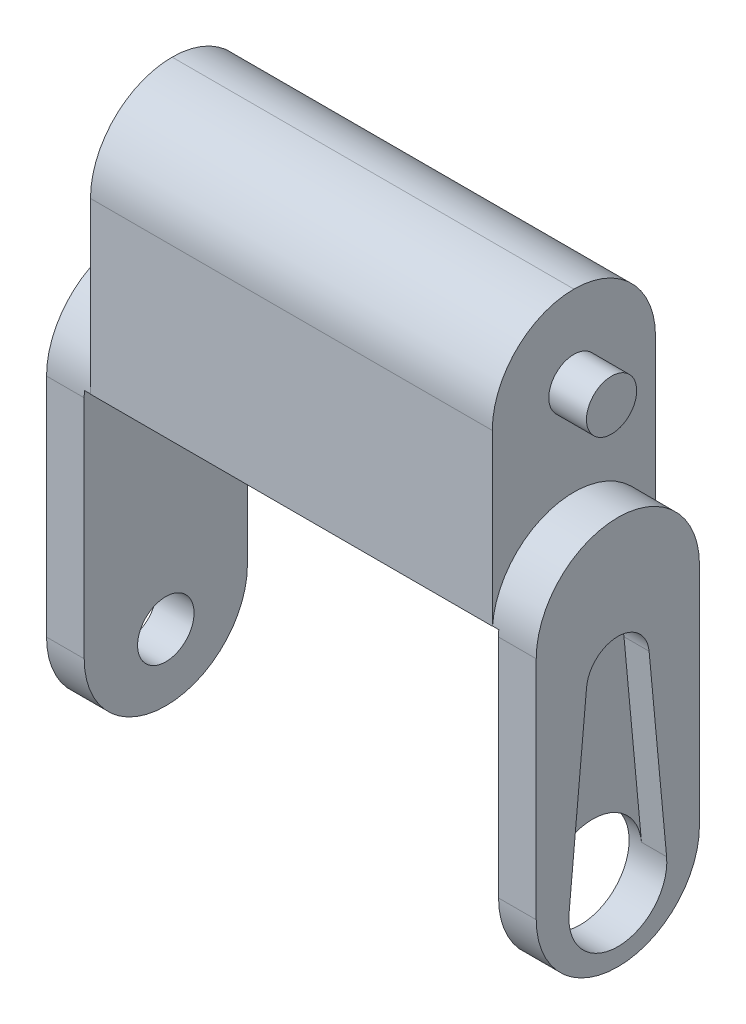
from build123d import *

# Parameters (mm, degrees)
BOSS_EXTRUDE1_DEPTH = 13
SKETCH2_R           = 2.25
CUT_EXTRUDE1_DEPTH  = 3
SKETCH3_R           = 2
BOSS_EXTRUDE3_DEPTH = 3
BOSS_EXTRUDE4_START = 3
SKETCH4_R           = 2
BOSS_EXTRUDE4_DEPTH = 3
CUT_EXTRUDE2_DEPTH  = 3.5
CUT_EXTRUDE3_START  = -3.5
CUT_EXTRUDE3_DEPTH  = 3.5
FILLET1_R           = 6.5
SKETCH7_R           = 3.9
CUT_EXTRUDE4_DEPTH  = 60.076221951
CUT_EXTRUDE5_START  = -2
CUT_EXTRUDE5_DEPTH  = 2


with BuildPart() as part:
    # Sketch1 → Boss-Extrude1 (new body)
    with BuildSketch(Plane.XY):
        Polygon((3, 0), (3, 25), (36, 25), (36, 0), (39, 0), (39, 31), (35.5, 31), (35.5, 45), (3.5, 45), (3.5, 31), (0, 31), (0, 0), align=None)
    extrude(amount=BOSS_EXTRUDE1_DEPTH)

    # Sketch2 → Cut-Extrude1 (cut)
    with BuildSketch(Plane.ZY):
        with Locations((6.5, 5.293988539)):
            Circle(SKETCH2_R)
    extrude(amount=-CUT_EXTRUDE1_DEPTH, mode=Mode.SUBTRACT)

    # Sketch3 → Boss-Extrude3 (add)
    with BuildSketch(Plane.ZY.offset(-3.5)):
        with Locations(Location((6.5, 38.5, 0), (0, 0, 180))):
            Circle(SKETCH3_R)
    extrude(amount=BOSS_EXTRUDE3_DEPTH)

    # Sketch4 → Boss-Extrude4 (add)
    with BuildSketch(Plane(origin=(35.5, 0, 0), x_dir=(0, 0, -1), z_dir=(1, 0, 0)).offset(BOSS_EXTRUDE4_START)):
        with Locations((-6.5, 38.5)):
            Circle(SKETCH4_R)
    extrude(amount=-BOSS_EXTRUDE4_DEPTH)

    # Sketch5 → Cut-Extrude2 (cut)
    with BuildSketch(Plane.ZY):
        with BuildLine():
            Line((0, 24.5), (0, 34.231050233))
            Line((0, 34.231050233), (13, 34.231050233))
            Line((13, 34.231050233), (13, 24.5))
            ThreePointArc((13, 24.5), (6.5, 31), (0, 24.5))
        make_face()
    extrude(amount=-CUT_EXTRUDE2_DEPTH, mode=Mode.SUBTRACT)

    # Sketch6 → Cut-Extrude3 (cut)
    with BuildSketch(Plane(origin=(39, 0, 0), x_dir=(0, 0, -1), z_dir=(1, 0, 0)).offset(CUT_EXTRUDE3_START)):
        with BuildLine():
            Line((-13, 24.5), (-13, 34.712302794))
            Line((-13, 34.712302794), (0, 34.712302794))
            Line((0, 34.712302794), (0, 24.5))
            ThreePointArc((0, 24.5), (-6.5, 31), (-13, 24.5))
        make_face()
    extrude(amount=CUT_EXTRUDE3_DEPTH, mode=Mode.SUBTRACT)

    # Fillet1
    fillet1_edges = [part.edges().sort_by_distance(p)[0] for p in [
        (37.5, 0, 13),
        (37.5, 0, 0),
        (1.5, 0, 0),
        (1.5, 0, 13),
        (19.5, 45, 0),
        (19.5, 45, 13),
    ]]
    fillet(fillet1_edges, radius=FILLET1_R - 0.0001)  # a hair under: the kernel refuses the full size

    # Sketch7 → Cut-Extrude4 (cut, through all)
    with BuildSketch(Plane.ZY.offset(-36)):
        with Locations(Location((6.5, 5.293988539, 0), (0, 0, 270))):
            Circle(SKETCH7_R)
    extrude(amount=-CUT_EXTRUDE4_DEPTH, mode=Mode.SUBTRACT)

    # Sketch8 → Cut-Extrude5 (cut)
    with BuildSketch(Plane(origin=(39, 0, 0), x_dir=(0, 0, -1), z_dir=(1, 0, 0)).offset(CUT_EXTRUDE5_START)):
        with BuildLine():
            Line((-2.617023822, 5.657988539), (-4.010912706, 20.527321872))
            ThreePointArc((-4.010912706, 20.527321872), (-6.5, 22.793988539), (-8.989087294, 20.527321872))
            Line((-8.989087294, 20.527321872), (-10.382976178, 5.657988539))
            ThreePointArc((-10.382976178, 5.657988539), (-6.5, 1.393988539), (-2.617023822, 5.657988539))
        make_face()
    extrude(amount=CUT_EXTRUDE5_DEPTH, mode=Mode.SUBTRACT)


solid = part.part
